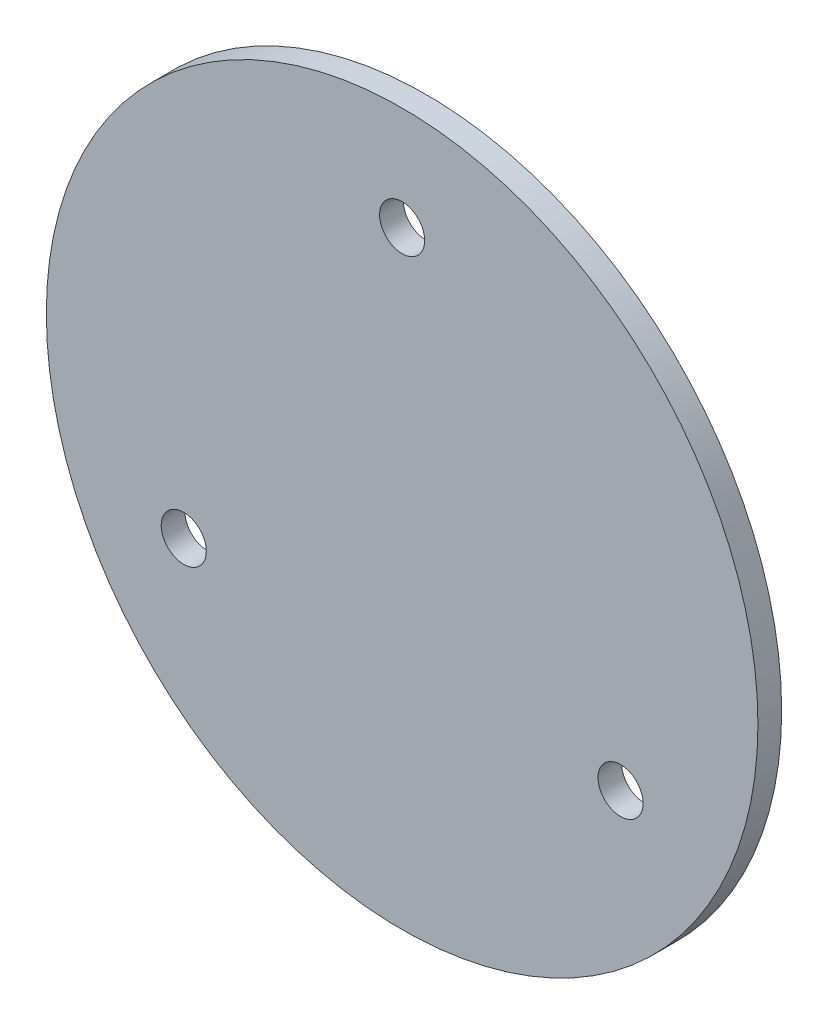
from build123d import *

# Parameters (mm, degrees)
SKETCH_1_R               = 30
EXTRUDE_1_DEPTH          = 2
CUT_EXTRUDE_1_DEPTH      = 43.473521163
CUT_EXTRUDE_1_DEPTH_BACK = 43.473521163
SKETCH_2_R               = 1.9


with BuildPart() as part:
    # ｽｹｯﾁ1 → ﾎﾞｽ - 押し出し1 (new body)
    with BuildSketch(Plane.XY):
        Circle(SKETCH_1_R)
    extrude(amount=EXTRUDE_1_DEPTH)

    # ｽｹｯﾁ2 → ｶｯﾄ - 押し出し1 (cut, two sides: drawn at the far end of the back side and taken through both)
    with BuildSketch(Plane.XY.offset(-CUT_EXTRUDE_1_DEPTH_BACK)):
        with Locations((0, 21.263)):
            Circle(SKETCH_2_R)
        with Locations((18.414298161, -10.6315)):
            Circle(SKETCH_2_R)
        with Locations((-18.414298161, -10.6315)):
            Circle(SKETCH_2_R)
    extrude(amount=CUT_EXTRUDE_1_DEPTH + CUT_EXTRUDE_1_DEPTH_BACK, mode=Mode.SUBTRACT)


solid = part.part
